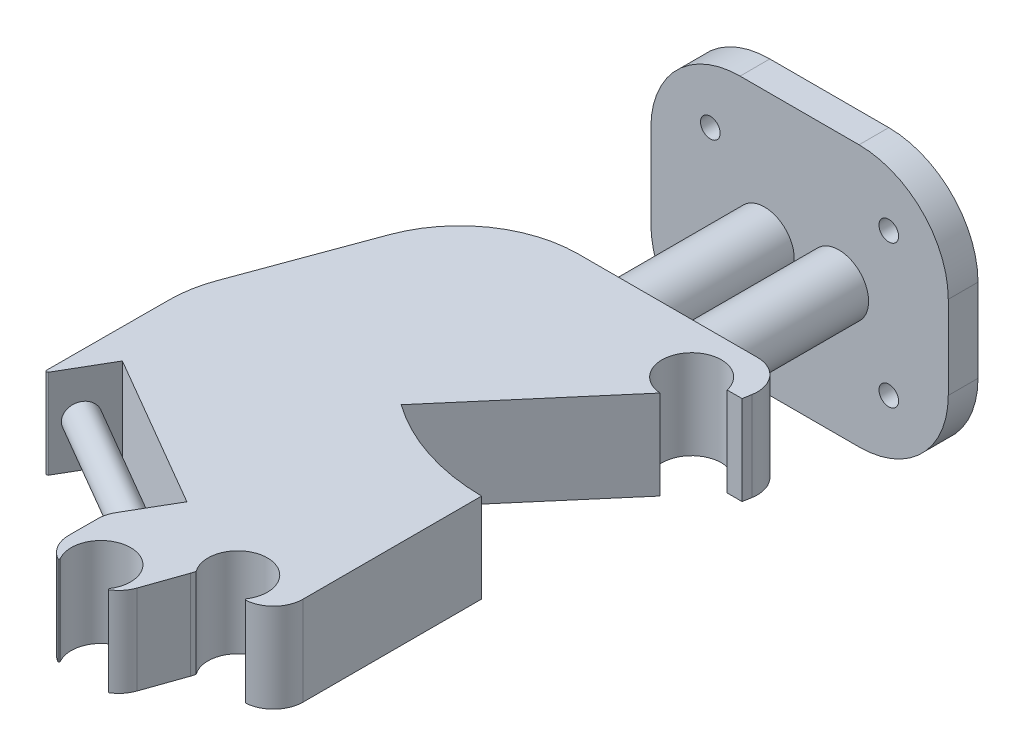
from build123d import *

# Parameters (mm, degrees)
SKETCH1_W                      = 5
SKETCH1_H                      = 25
BOSS_EXTRUDE1_DEPTH            = 10
BOSS_EXTRUDE2_DEPTH            = 2.5
BOSS_EXTRUDE3_START            = 2.5
BOSS_EXTRUDE3_DEPTH            = 2.5
SKETCH5_W                      = 50
SKETCH5_H                      = 44
SKETCH5_R                      = 1.65
BOSS_EXTRUDE4_DEPTH            = 5
DRAFT1_ANGLE                   = 60
DRAFT2_ANGLE                   = -10
SKETCH6_W                      = 5
SKETCH6_H                      = 15
SKETCH7_W                      = 5
SKETCH7_H                      = 15
SKETCH8_W                      = 5
SKETCH8_H                      = 25
F_10_0_10_DIAMETER_HOLE1_D     = 10
F_10_0_10_DIAMETER_HOLE1_DEPTH = 29.5
FILLET1_R                      = 5
FILLET2_R                      = 20
FILLET3_R                      = 15


with BuildPart() as part:
    # Sketch1 → Revolve1 (revolve)
    with BuildSketch(Plane(origin=(0, -7.5, 0), x_dir=(1, 0, 0), z_dir=(0, 1, 0))):
        with Locations((-5.811233855, 90.876419512)):
            Rectangle(SKETCH1_W, SKETCH1_H)
    revolve(axis=Axis((-8.311233855, -7.5, -103.376419512), (0, 0, 1)))

    # Sketch2 → Boss-Extrude1 (add)
    with BuildSketch(Plane(origin=(0, -2.5, 0), x_dir=(1, 0, 0), z_dir=(0, 1, 0))):
        with BuildLine():
            Line((-20.904218066, -4.060593221), (-17.745761276, -10))
            ThreePointArc((-17.745761276, -10), (-16.42436709, -8.86625844), (-15.571850751, -7.348145002))
            Line((-15.571850751, -7.348145002), (-13.235172111, -0.671920317))
            ThreePointArc((-13.235172111, -0.671920317), (-13.124251068, -0.312083076), (-13.040724348, 0.055081199))
            ThreePointArc((-13.040724348, 0.055081199), (-9.034250588, -1.999882688), (-5, 0))
            ThreePointArc((-5, 0), (-1.464466094, 1.464466094), (0, 5))
            Line((0, 5), (0, 35))
            ThreePointArc((0, 35), (-10.533604853, 36.723434751), (-20.057952451, 41.541511272))
            Line((-20.057952451, 41.541511272), (5.197843412, 71.090018979))
            Line((5.197843412, 71.090018979), (8.982632418, 71.090018979))
            Line((8.982632418, 71.090018979), (8.982632418, 78.376419512))
            Line((8.982632418, 78.376419512), (-8.311233855, 78.376419512))
            Line((-8.311233855, 78.376419512), (-41.017367582, 78.376419512))
            Line((-41.017367582, 78.376419512), (-54.819345863, 40.83303933))
            Line((-54.819345863, 40.83303933), (-54.896976862, 16.766177236))
            ThreePointArc((-54.896976862, 16.766177236), (-54.712461515, 16.524099343), (-54.430876141, 16.639673113))
            Line((-54.430876141, 16.639673113), (-49.872077715, 24.477250263))
            Line((-49.872077715, 24.477250263), (-8.967847829, 0.684930874))
            Line((-8.967847829, 0.684930874), (-28.967743782, 0.74944331))
            Line((-28.967743782, 0.74944331), (-28.987601327, -5.406715976))
            ThreePointArc((-28.987601327, -5.406715976), (-28.311946244, -7.932877153), (-26.453503439, -9.772494077))
            Line((-26.453503439, -9.772494077), (-20.904218066, -4.060593221))
        make_face()
    extrude(amount=-BOSS_EXTRUDE1_DEPTH)

    # Sketch3 → Boss-Extrude2 (add)
    with BuildSketch(Plane.XZ.offset(12.5)):
        with BuildLine():
            Line((-20.904218066, 4.060593221), (-17.745761276, 10))
            ThreePointArc((-17.745761276, 10), (-16.42436709, 8.86625844), (-15.571850751, 7.348145002))
            Line((-15.571850751, 7.348145002), (-13.235172111, 0.671920317))
            ThreePointArc((-13.235172111, 0.671920317), (-13.124251068, 0.312083076), (-13.040724348, -0.055081199))
            ThreePointArc((-13.040724348, -0.055081199), (-9.034250588, 1.999882688), (-5, 0))
            ThreePointArc((-5, 0), (-1.464466094, -1.464466094), (0, -5))
            Line((0, -5), (0, -35))
            ThreePointArc((0, -35), (-10.533604853, -36.723434751), (-20.057952451, -41.541511272))
            Line((-20.057952451, -41.541511272), (5.197843412, -71.090018979))
            Line((5.197843412, -71.090018979), (8.982632418, -71.090018979))
            Line((8.982632418, -71.090018979), (8.982632418, -78.376419512))
            Line((8.982632418, -78.376419512), (-41.017367582, -78.376419512))
            Line((-41.017367582, -78.376419512), (-54.819345863, -40.83303933))
            Line((-54.819345863, -40.83303933), (-54.896976862, -16.766177236))
            ThreePointArc((-54.896976862, -16.766177236), (-54.712461515, -16.524099343), (-54.430876141, -16.639673113))
            Line((-54.430876141, -16.639673113), (-49.872077715, -24.477250263))
            Line((-49.872077715, -24.477250263), (-8.967847829, -0.684930874))
            Line((-8.967847829, -0.684930874), (-28.967743782, -0.74944331))
            Line((-28.967743782, -0.74944331), (-28.987601327, 5.406715976))
            ThreePointArc((-28.987601327, 5.406715976), (-28.311946244, 7.932877153), (-26.453503439, 9.772494077))
            Line((-26.453503439, 9.772494077), (-20.904218066, 4.060593221))
        make_face()
    extrude(amount=BOSS_EXTRUDE2_DEPTH)

    # Sketch4 → Boss-Extrude3 (add)
    with BuildSketch(Plane(origin=(0, -2.5, 0), x_dir=(-1, 0, 0), z_dir=(0, 1, 0)).offset(BOSS_EXTRUDE3_START)):
        with BuildLine():
            Line((20.904218066, 4.060593221), (26.453503439, 9.772494077))
            ThreePointArc((26.453503439, 9.772494077), (28.311946244, 7.932877153), (28.987601327, 5.406715976))
            Line((28.987601327, 5.406715976), (28.967743782, -0.74944331))
            Line((28.967743782, -0.74944331), (8.967847829, -0.684930874))
            Line((8.967847829, -0.684930874), (49.872077715, -24.477250263))
            Line((49.872077715, -24.477250263), (54.430876141, -16.639673113))
            ThreePointArc((54.430876141, -16.639673113), (54.712461515, -16.524099343), (54.896976862, -16.766177236))
            Line((54.896976862, -16.766177236), (54.819345863, -40.83303933))
            Line((54.819345863, -40.83303933), (41.017367582, -78.376419512))
            Line((41.017367582, -78.376419512), (-8.982632418, -78.376419512))
            Line((-8.982632418, -78.376419512), (-8.982632418, -71.090018979))
            Line((-8.982632418, -71.090018979), (-5.197843412, -71.090018979))
            Line((-5.197843412, -71.090018979), (20.057952451, -41.541511272))
            ThreePointArc((20.057952451, -41.541511272), (10.533604853, -36.723434751), (0, -35))
            Line((0, -35), (0, -5))
            ThreePointArc((0, -5), (1.464466094, -1.464466094), (5, 0))
            ThreePointArc((5, 0), (9.034250588, 1.999882688), (13.040724348, -0.055081199))
            ThreePointArc((13.040724348, -0.055081199), (13.124251068, 0.312083076), (13.235172111, 0.671920317))
            Line((13.235172111, 0.671920317), (15.571850751, 7.348145002))
            ThreePointArc((15.571850751, 7.348145002), (16.42436709, 8.86625844), (17.745761276, 10))
            Line((17.745761276, 10), (20.904218066, 4.060593221))
        make_face()
    extrude(amount=-BOSS_EXTRUDE3_DEPTH)

    # Sketch5 → Boss-Extrude4 (add)
    with BuildSketch(Plane.XY.offset(-103.376419512)):
        with Locations((-14.91763051, -7.5)):
            Rectangle(SKETCH5_W, SKETCH5_H)
        with Locations((-29.91763051, -19.5)):
            Circle(SKETCH5_R, mode=Mode.SUBTRACT)
        with Locations((0.08236949, -19.5)):
            Circle(SKETCH5_R, mode=Mode.SUBTRACT)
        with Locations((0.08236949, 4.5)):
            Circle(SKETCH5_R, mode=Mode.SUBTRACT)
        with Locations((-29.91763051, 4.5)):
            Circle(SKETCH5_R, mode=Mode.SUBTRACT)
    extrude(amount=-BOSS_EXTRUDE4_DEPTH)

    # Draft1
    draft1_faces = [part.faces().sort_by_distance(p)[0] for p in [
        (-18.967795805, -7.5, -0.717187092),
    ]]
    draft(draft1_faces, Plane(origin=(-28.967743782, -12.5, -0.74944331), x_dir=(0.0032256218002524395, 0, -0.9999947976684688), z_dir=(-0.9999947976684688, 0, -0.0032256218002524395)), DRAFT1_ANGLE)

    # Draft2
    draft2_faces = [part.faces().sort_by_distance(p)[0] for p in [
        (8.982632418, -7.5, -74.733219246),
    ]]
    draft(draft2_faces, Plane(origin=(-8.311233855, -12.5, -78.376419512), x_dir=(-1, 0, 0), z_dir=(0, 0, -1)), DRAFT2_ANGLE)

    # Sketch6 → Cut-Revolve1 (revolve, cut)
    with BuildSketch(Plane.XY.offset(7)):
        with Locations((-19.5, -7.5)):
            Rectangle(SKETCH6_W, SKETCH6_H)
    revolve(axis=Axis((-22, 0, 7), (0, -1, 0)), mode=Mode.SUBTRACT)

    # Sketch7 → Cut-Revolve2 (revolve, cut)
    with BuildSketch(Plane(origin=(0, 0, -3), x_dir=(-1, 0, 0), z_dir=(0, 0, -1))):
        with Locations((6.5, -7.5)):
            Rectangle(SKETCH7_W, SKETCH7_H)
    revolve(axis=Axis((-9, -15, -3), (0, 1, 0)), mode=Mode.SUBTRACT)

    # Sketch8 → Revolve2 (revolve)
    with BuildSketch(Plane(origin=(0, -7.5, 0), x_dir=(1, 0, 0), z_dir=(0, 1, 0))):
        with Locations((-18.311233855, 90.876419512)):
            Rectangle(SKETCH8_W, SKETCH8_H)
    revolve(axis=Axis((-20.811233855, -7.5, -103.376419512), (0, 0, 1)))

    # Sketch9 → Revolve3 (revolve)
    with BuildSketch(Plane(origin=(0, -7.5, 0), x_dir=(1, 0, 0), z_dir=(0, 1, 0))):
        Polygon((-51.129054889, 22.316230044), (-52.386032062, 20.155209826), (-26.453789436, 5.071483748), (-25.196812263, 7.232503967), align=None)
    revolve(axis=Axis((-53.325247092, -7.5, -20.701512837), (0.8644080875330462, 0, 0.502790869256256)))

    # Ø10.0 (10) Diameter Hole1
    with Locations(Plane(origin=(0, -15, 0), x_dir=(-1, 0, 0), z_dir=(0, -1, 0))):
        with Locations((-0.318427602, 69.998551454)):
            Hole(F_10_0_10_DIAMETER_HOLE1_D / 2, depth=F_10_0_10_DIAMETER_HOLE1_DEPTH)

    # Chamfer1
    # the kernel refuses this chamfer: 0.262951912, 0.262770817 mm, written as the material it takes off along each edge
    with BuildSketch(Plane(origin=(-5, -15.679311202, 0), x_dir=(0.9996632496701223, 4.862291359988254e-15, -0.02594970633688609), z_dir=(0, 1, 0))) as chamfer1_piece_1:
        with BuildLine():
            Line((0.259497063, 0), (0.159812325, 0.213399124))
            ThreePointArc((0.159812325, 0.213399124), (0.082816569, 0.107621918), (0, 0))
            ThreePointArc((0, 0), (0.131972937, -0.001683257), (0.259497063, 0))
        make_face()
    extrude(amount=16.358622404, mode=Mode.SUBTRACT)

    # Fillet1
    fillet1_edges = [part.edges().sort_by_distance(p)[0] for p in [
        (-28.967743782, -7.5, -0.74944331),
        (8.982632418, -7.5, -78.376419512),
    ]]
    fillet(fillet1_edges, radius=FILLET1_R)

    # Fillet2
    fillet2_edges = [part.edges().sort_by_distance(p)[0] for p in [
        (-41.017367582, -7.5, -78.376419512),
        (-54.819345863, -7.5, -40.83303933),
    ]]
    fillet(fillet2_edges, radius=FILLET2_R)

    # Fillet3
    fillet3_edges = [part.edges().sort_by_distance(p)[0] for p in [
        (-39.91763051, -29.5, -105.876419512),
        (-39.91763051, 14.5, -105.876419512),
        (10.08236949, 14.5, -105.876419512),
        (10.08236949, -29.5, -105.876419512),
    ]]
    fillet(fillet3_edges, radius=FILLET3_R)


solid = part.part
